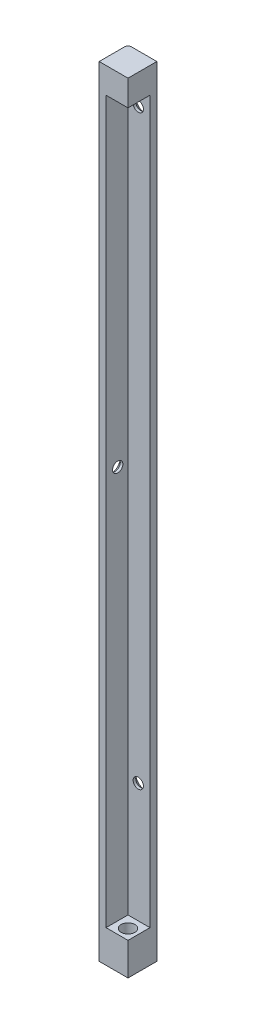
from build123d import *
from build123d.topology import SkipClean

# Parameters (mm, degrees)
BOSS_EXTRUDE1_DEPTH                                 = 221.5
CSK_FOR_M3_COUNTERSUNK_FLAT_HEAD_SCREW1_D           = 3
CSK_FOR_M3_COUNTERSUNK_FLAT_HEAD_SCREW1_CSINK_D     = 5.5
CSK_FOR_M3_COUNTERSUNK_FLAT_HEAD_SCREW1_CSINK_ANGLE = 90
CSK_FOR_M3_COUNTERSUNK_FLAT_HEAD_SCREW4_D           = 3
CSK_FOR_M3_COUNTERSUNK_FLAT_HEAD_SCREW4_CSINK_D     = 5.5
CSK_FOR_M3_COUNTERSUNK_FLAT_HEAD_SCREW4_CSINK_ANGLE = 90
SKETCH12_W                                          = 8
SKETCH12_H                                          = 7
BOSS_EXTRUDE2_DEPTH                                 = 5.5
CUT_EXTRUDE1_DEPTH                                  = 359
BOSS_EXTRUDE3_DEPTH                                 = 3
BOSS_EXTRUDE4_DEPTH                                 = 2.5
BOSS_EXTRUDE4_DEPTH_BACK                            = 6
SKETCH19_W                                          = 0.6
SKETCH19_H                                          = 227
CUT_EXTRUDE2_DEPTH                                  = 10
SKETCH20_W                                          = 15.604741464
SKETCH20_H                                          = 2
CUT_EXTRUDE3_DEPTH                                  = 10
SKETCH21_W                                          = 0.6
SKETCH21_H                                          = 225
CUT_EXTRUDE4_DEPTH                                  = 10
SKETCH22_W                                          = 8.4
SKETCH22_H                                          = 5.5
CUT_EXTRUDE5_DEPTH                                  = 10
BOSS_EXTRUDE5_DEPTH                                 = 2
TAP_DRILL_FOR_M4X0_7_TAP1_D                         = 4
TAP_DRILL_FOR_M4X0_7_TAP1_DEPTH                     = 5
BOSS_EXTRUDE6_DEPTH                                 = 221.5
FILLET1_R                                           = 1
SKETCH30_R                                          = 2
BOSS_EXTRUDE7_DEPTH                                 = 4.5
BOSS_EXTRUDE8_DEPTH                                 = 1


with BuildPart() as part:
    # Sketch1 → Boss-Extrude1 (new body)
    with BuildSketch(Plane(origin=(0, 0, 0), x_dir=(1, 0, 0), z_dir=(0, 1, 0))):
        Polygon((0, 0), (0, 9), (9, 9), (9, 7), (2, 7), (2, 0), align=None)
    extrude(amount=BOSS_EXTRUDE1_DEPTH)

    # CSK for M3 Countersunk Flat Head Screw1 (through all)
    with Locations(Plane.ZY):
        with Locations((-4, 120)):
            CounterSinkHole(CSK_FOR_M3_COUNTERSUNK_FLAT_HEAD_SCREW1_D / 2, CSK_FOR_M3_COUNTERSUNK_FLAT_HEAD_SCREW1_CSINK_D / 2, counter_sink_angle=CSK_FOR_M3_COUNTERSUNK_FLAT_HEAD_SCREW1_CSINK_ANGLE)

    # CSK for M3 Countersunk Flat Head Screw4 (through all)
    with Locations(Plane(origin=(0, 0, -9), x_dir=(-1, 0, 0), z_dir=(0, 0, -1))):
        with Locations((-5, 40.25), (-5, 211)):
            CounterSinkHole(CSK_FOR_M3_COUNTERSUNK_FLAT_HEAD_SCREW4_D / 2, CSK_FOR_M3_COUNTERSUNK_FLAT_HEAD_SCREW4_CSINK_D / 2, counter_sink_angle=CSK_FOR_M3_COUNTERSUNK_FLAT_HEAD_SCREW4_CSINK_ANGLE)

    # Sketch12 → Boss-Extrude2 (add)
    with BuildSketch(Plane.XZ):
        with Locations((5, -3.5)):
            Rectangle(SKETCH12_W, SKETCH12_H)
    extrude(amount=-BOSS_EXTRUDE2_DEPTH)

    # Sketch13 → Cut-Extrude1 (cut)
    with BuildSketch(Plane(origin=(0, 221.5, 0), x_dir=(1, 0, 0), z_dir=(0, 1, 0))):
        Polygon((0, 8), (1, 9), (0, 9), align=None)
    extrude(amount=-CUT_EXTRUDE1_DEPTH, mode=Mode.SUBTRACT)

    # Sketch14 → Boss-Extrude3 (add)
    with BuildSketch(Plane.XZ):
        Polygon((0, 0), (9, 0), (9, -9), (1, -9), (0, -8), align=None)
    extrude(amount=BOSS_EXTRUDE3_DEPTH)

    # Sketch18 → Boss-Extrude4 (add, two sides: drawn at the far end of the back side and taken through both)
    with BuildSketch(Plane(origin=(0, 221.5, 0), x_dir=(1, 0, 0), z_dir=(0, 1, 0)).offset(-BOSS_EXTRUDE4_DEPTH_BACK)):
        Polygon((0, 0), (9, 0), (9, 9), (1, 9), (0, 8), align=None)
    extrude(amount=BOSS_EXTRUDE4_DEPTH + BOSS_EXTRUDE4_DEPTH_BACK)

    # Sketch19 → Cut-Extrude2 (cut)
    with BuildSketch(Plane.ZY):
        with Locations((-0.3, 110.5)):
            Rectangle(SKETCH19_W, SKETCH19_H)
    extrude(amount=-CUT_EXTRUDE2_DEPTH, mode=Mode.SUBTRACT)

    # Sketch20 → Cut-Extrude3 (cut)
    with BuildSketch(Plane.ZY):
        with Locations((-8.402370732, 223)):
            Rectangle(SKETCH20_W, SKETCH20_H)
    extrude(amount=-CUT_EXTRUDE3_DEPTH, mode=Mode.SUBTRACT)

    # Sketch21 → Cut-Extrude4 (cut)
    with BuildSketch(Plane(origin=(0, 0, -9), x_dir=(-1, 0, 0), z_dir=(0, 0, -1))):
        with Locations((-8.7, 109.5)):
            Rectangle(SKETCH21_W, SKETCH21_H)
    extrude(amount=-CUT_EXTRUDE4_DEPTH, mode=Mode.SUBTRACT)

    # Sketch22 → Cut-Extrude5 (cut)
    with BuildSketch(Plane(origin=(0, 0, -9), x_dir=(-1, 0, 0), z_dir=(0, 0, -1))):
        with Locations((-4.2, -0.25)):
            Rectangle(SKETCH22_W, SKETCH22_H)
    extrude(amount=-CUT_EXTRUDE5_DEPTH, mode=Mode.SUBTRACT)

    # Sketch26 → Boss-Extrude5 (add)
    with BuildSketch(Plane.XZ.offset(-2.5)):
        Polygon((8.4, -9), (8.4, -0.6), (0, -0.6), (0, -8), (1, -9), align=None)
    extrude(amount=BOSS_EXTRUDE5_DEPTH)

    # Tap Drill for M4x0.7 Tap1
    with Locations(Plane(origin=(0, 0.5, 0), x_dir=(-1, 0, 0), z_dir=(0, -1, 0))):
        with Locations((-5.4, 3.6)):
            Hole(TAP_DRILL_FOR_M4X0_7_TAP1_D / 2, depth=TAP_DRILL_FOR_M4X0_7_TAP1_DEPTH)

    # Sketch29 → Boss-Extrude6 (add)
    with BuildSketch(Plane(origin=(0, 222, 0), x_dir=(1, 0, 0), z_dir=(0, 1, 0))):
        Polygon((0, 8), (1, 9), (0, 9), align=None)
    extrude(amount=-BOSS_EXTRUDE6_DEPTH)

    # Fillet1
    fillet1_edges = [part.edges().sort_by_distance(p)[0] for p in [
        (0, 111.25, -9),
    ]]
    fillet(fillet1_edges, radius=FILLET1_R)

    # Sketch30 → Boss-Extrude7 (add)
    with SkipClean():  # the faces are left unmerged after this step: merging them gives an invalid solid
        with BuildSketch(Plane.XZ.offset(-0.5)):
            with BuildLine():
                Line((0, -0.6), (8.4, -0.6))
                Line((8.4, -0.6), (8.4, -9))
                Line((8.4, -9), (1, -9))
                ThreePointArc((1, -9), (0.292893219, -8.707106781), (0, -8))
                Line((0, -8), (0, -0.6))
            make_face()
            with Locations(Location((5.4, -3.6, 0), (0, 0, 270))):
                Circle(SKETCH30_R, mode=Mode.SUBTRACT)
        extrude(amount=BOSS_EXTRUDE7_DEPTH)
    add(part.part.scale(1), mode=Mode.REPLACE)  # the faces are merged on a copy

    # Sketch32 → Boss-Extrude8 (add)
    with SkipClean():  # the faces are left unmerged after this step: merging them gives an invalid solid
        with BuildSketch(Plane(origin=(0, 222, 0), x_dir=(1, 0, 0), z_dir=(0, 1, 0))):
            with BuildLine():
                Line((0, 0.6), (8.4, 0.6))
                Line((8.4, 0.6), (8.4, 9))
                Line((8.4, 9), (1, 9))
                ThreePointArc((1, 9), (0.292893219, 8.707106781), (0, 8))
                Line((0, 8), (0, 0.6))
            make_face()
        extrude(amount=BOSS_EXTRUDE8_DEPTH)


solid = part.part
